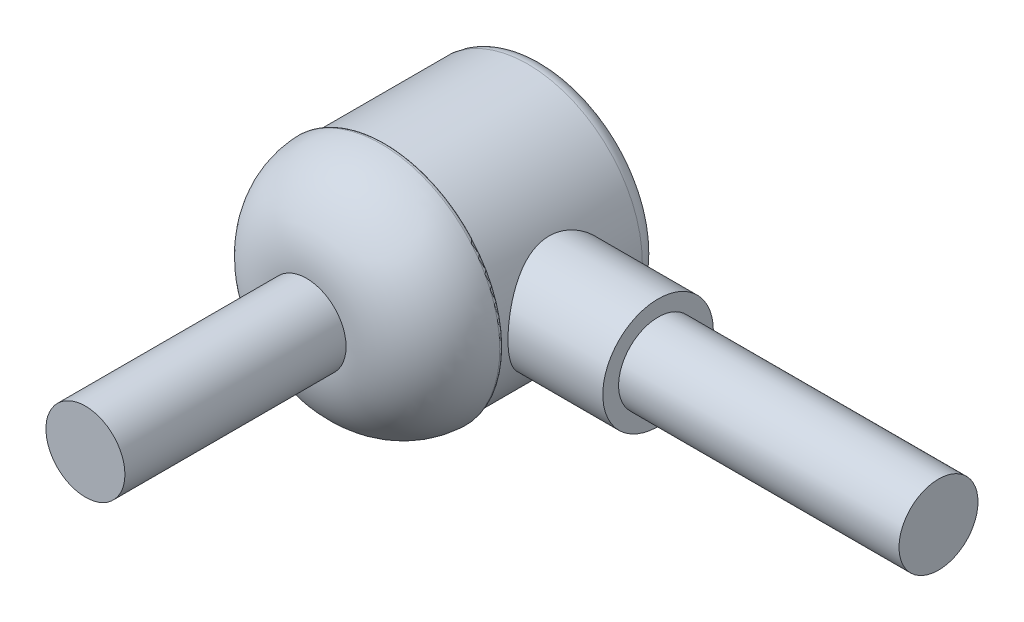
from build123d import *

# Parameters (mm, degrees)
SZKIC1_R                         = 14.5
DODANIE_WYCI_GNI_CIE1_DEPTH      = 20
SZKIC2_R                         = 15
DODANIE_WYCI_GNI_CIE2_DEPTH      = 10
ZAOKR_GLENIE1_R                  = 10
SZKIC3_R                         = 5
DODANIE_WYCI_GNI_CIE3_DEPTH      = 28
ZAOKR_GLENIE2_R                  = 0.5
ZAOKR_GLENIE3_R                  = 2
DODANIE_WYCI_GNI_CIE4_REACH      = 74.868
DODANIE_WYCI_GNI_CIE4_END_RADIUS = 14.5
SZKIC4_R                         = 7
SZKIC5_R                         = 5
DODANIE_WYCI_GNI_CIE5_DEPTH      = 35.5


# Some blends are built 0.0001 mm under size
with BuildPart() as part:
    # Szkic1 → Dodanie-wyciągnięcie1 (new body)
    with BuildSketch(Plane.XY):
        Circle(SZKIC1_R)
    extrude(amount=DODANIE_WYCI_GNI_CIE1_DEPTH)

    # Szkic2 → Dodanie-wyciągnięcie2 (add)
    with BuildSketch(Plane.XY.offset(20)):
        Circle(SZKIC2_R)
    extrude(amount=DODANIE_WYCI_GNI_CIE2_DEPTH)

    # Zaokrąglenie1
    zaokr_glenie1_edges = [part.edges().sort_by_distance(p)[0] for p in [
        (-15, 0, 30),
    ]]
    fillet(zaokr_glenie1_edges, radius=ZAOKR_GLENIE1_R - 0.0001)  # a hair under: the kernel refuses the full size

    # Szkic3 → Dodanie-wyciągnięcie3 (add)
    with BuildSketch(Plane.XY.offset(30)):
        Circle(SZKIC3_R)
    extrude(amount=DODANIE_WYCI_GNI_CIE3_DEPTH)

    # Zaokrąglenie2
    # the kernel refuses this fillet: 0.5 mm, written as the material it takes off along each edge
    with BuildSketch(Plane(origin=(0, 0, 20), x_dir=(1, 0, 0), z_dir=(0, -1, 0))) as zaokr_glenie2_piece_1_section:
        with BuildLine():
            CenterArc((14.486838112, 0.5), ZAOKR_GLENIE2_R, 270, 93.01638914)
            Line((14.486838112, 0), (14.486838112, -0.05))
            Line((14.486838112, -0.05), (15, -0.05))
            Line((15, -0.05), (15.05, 0))
            ThreePointArc((15.05, 0), (15.05, 0.0001), (15.0360761, 0.528941884))
            Line((15.0360761, 0.528941884), (14.986145373, 0.526310803))
        make_face()
    zaokr_glenie2_piece_1 = revolve(axis=Axis((0, 0, 20), (0, 0, 1)), mode=Mode.PRIVATE)
    zaokr_glenie2_piece_1 = zaokr_glenie2_piece_1 - Plane(origin=(0, 0, 20.145882789), x_dir=(1, 0, 0), z_dir=(0, 0, -1)) * Cylinder(14.5, 61, mode=Mode.PRIVATE)
    add(zaokr_glenie2_piece_1, mode=Mode.SUBTRACT)

    # Zaokrąglenie3
    zaokr_glenie3_edges = [part.edges().sort_by_distance(p)[0] for p in [
        (-14.5, 0, 0),
    ]]
    fillet(zaokr_glenie3_edges, radius=ZAOKR_GLENIE3_R)

    # Dodanie-wyciągnięcie4: up to this cylinder (the profile starts outside it)
    dodanie_wyci_gni_cie4_end = Plane(origin=(0, 0, 12), z_dir=(0, 0, -1)) * Cylinder(DODANIE_WYCI_GNI_CIE4_END_RADIUS, 179.736, mode=Mode.PRIVATE)
    # Szkic4 → Dodanie-wyciągnięcie4 (add, up to the surface)
    with BuildSketch(Plane(origin=(26.5, 0, 0), x_dir=(0, 0, -1), z_dir=(1, 0, 0)), mode=Mode.PRIVATE) as dodanie_wyci_gni_cie4_sk1:
        with Locations((-12, 0)):
            Circle(SZKIC4_R)
    dodanie_wyci_gni_cie4_tool1 = extrude(dodanie_wyci_gni_cie4_sk1.sketch, amount=-DODANIE_WYCI_GNI_CIE4_REACH, mode=Mode.PRIVATE) - dodanie_wyci_gni_cie4_end
    add(dodanie_wyci_gni_cie4_tool1.solids().sort_by_distance((26.5, 0, 12))[0])

    # Szkic5 → Dodanie-wyciągnięcie5 (add)
    with BuildSketch(Plane(origin=(26.5, 0, 0), x_dir=(0, 0, -1), z_dir=(1, 0, 0))):
        with Locations((-12, 0)):
            Circle(SZKIC5_R)
    extrude(amount=DODANIE_WYCI_GNI_CIE5_DEPTH)


solid = part.part
